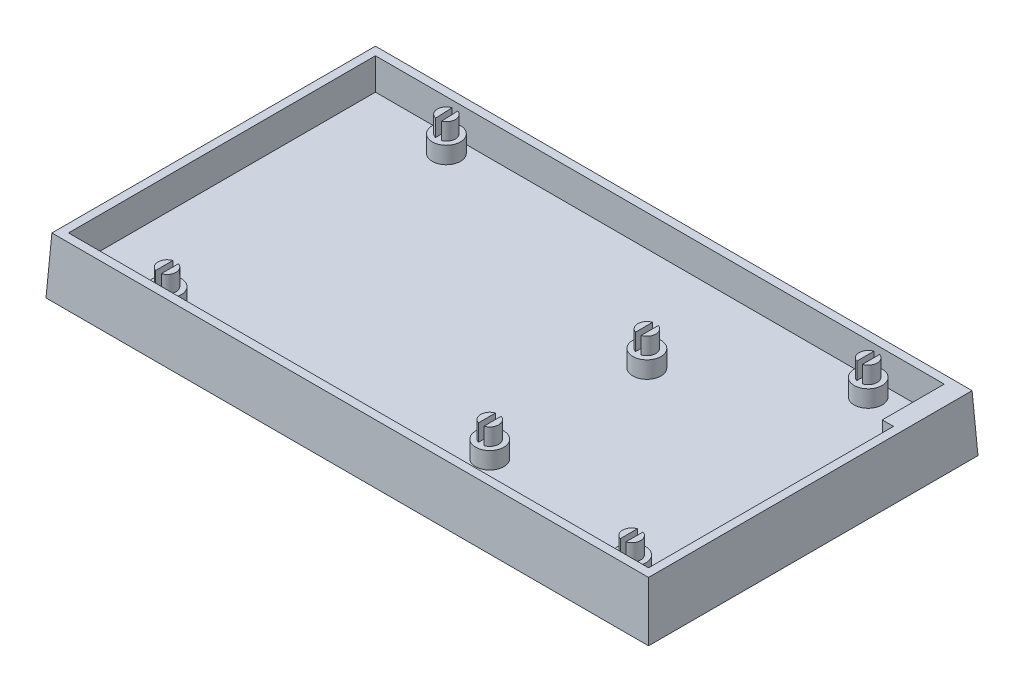
from build123d import *

# Parameters (mm, degrees)
SKETCH2_W           = 107
SKETCH2_H           = 58.5
BOSS_EXTRUDE1_DEPTH = 10
BOSS_EXTRUDE1_TAPER = 3
CUT_EXTRUDE1_START  = 10
SKETCH2_5_W         = 2
SKETCH2_5_H         = 1
CUT_EXTRUDE1_DEPTH  = 5.6
SKETCH8_W           = 107
SKETCH8_H           = 58.5
BOSS_EXTRUDE2_DEPTH = 5
BOSS_EXTRUDE2_TAPER = 45
SKETCH9_W           = 4
SKETCH9_H           = 20
BOSS_EXTRUDE3_DEPTH = 5
SKETCH10_R          = 2.5
BOSS_EXTRUDE4_DEPTH = 3
BOSS_EXTRUDE5_START = 7.4
BOSS_EXTRUDE5_DEPTH = 3


# Read off the part's stored shape, not the designer's step: Boss-Extrude5
with BuildPart() as part:
    # Sketch2 → Boss-Extrude1 (new body)
    with BuildSketch(Plane(origin=(0, 0, 0), x_dir=(1, 0, 0), z_dir=(0, 1, 0))):
        with Locations((51.5, 27.25)):
            Rectangle(SKETCH2_W, SKETCH2_H)
    extrude(amount=BOSS_EXTRUDE1_DEPTH, taper=BOSS_EXTRUDE1_TAPER)

    # Sketch2<5> → Cut-Extrude1 (cut)
    with BuildSketch(Plane(origin=(0, 0, 0), x_dir=(1, 0, 0), z_dir=(0, 1, 0)).offset(CUT_EXTRUDE1_START)):
        Polygon((0, 0), (101, 0), (101, 1), (103, 3), (103, 41.5), (101, 43.5), (101, 54.5), (0, 54.5), align=None)
        Polygon((103, 43.5), (101, 43.5), (103, 41.5), align=None)
        Polygon((103, 3), (101, 1), (103, 1), align=None)
        with Locations((102, 0.5)):
            Rectangle(SKETCH2_5_W, SKETCH2_5_H)
    extrude(amount=-CUT_EXTRUDE1_DEPTH, mode=Mode.SUBTRACT)

    # Sketch8 → Boss-Extrude2 (add)
    with BuildSketch(Plane.XZ):
        with Locations((51.5, -27.25)):
            Rectangle(SKETCH8_W, SKETCH8_H)
    extrude(amount=BOSS_EXTRUDE2_DEPTH, taper=BOSS_EXTRUDE2_TAPER)

    # Sketch9 → Boss-Extrude3 (add)
    with BuildSketch(Plane.XZ.offset(5)):
        with Locations((26.5, -27.25)):
            Rectangle(SKETCH9_W, SKETCH9_H)
        with Locations((76.5, -27.25)):
            Rectangle(SKETCH9_W, SKETCH9_H)
    extrude(amount=BOSS_EXTRUDE3_DEPTH)

    # Sketch10 → Boss-Extrude4 (add)
    # profile 1 of 6: a face of its own
    with BuildSketch(Plane(origin=(0, 4.4, 0), x_dir=(1, 0, 0), z_dir=(0, 1, 0))):
        with Locations(Location((15.7, 51.4, 0), (0, 0, 270))):
            Circle(SKETCH10_R)
    # profile 2 of 6: a face of its own
    with BuildSketch(Plane(origin=(0, 4.4, 0), x_dir=(1, 0, 0), z_dir=(0, 1, 0))):
        with Locations(Location((90.6, 51.4, 0), (0, 0, 270))):
            Circle(SKETCH10_R)
    # profile 3 of 6: a face of its own
    with BuildSketch(Plane(origin=(0, 4.4, 0), x_dir=(1, 0, 0), z_dir=(0, 1, 0))):
        with Locations(Location((66.5, 8.3, 0), (0, 0, 270))):
            Circle(SKETCH10_R)
    # profile 4 of 6: a face of its own
    with BuildSketch(Plane(origin=(0, 4.4, 0), x_dir=(1, 0, 0), z_dir=(0, 1, 0))):
        with Locations(Location((66.5, 36.2, 0), (0, 0, 270))):
            Circle(SKETCH10_R)
    # profile 5 of 6: a face of its own
    with BuildSketch(Plane(origin=(0, 4.4, 0), x_dir=(1, 0, 0), z_dir=(0, 1, 0))):
        with Locations(Location((96.9, 3.1, 0), (0, 0, 270))):
            Circle(SKETCH10_R)
        with BuildLine():
            ThreePointArc((96.4, 4.619868415), (96.9, 4.7), (97.4, 4.619868415))
            ThreePointArc((97.4, 4.619868415), (96.9, 1.5), (96.4, 4.619868415))
        make_face(mode=Mode.SUBTRACT)
    # profile 6 of 6: a face of its own
    with BuildSketch(Plane(origin=(0, 4.4, 0), x_dir=(1, 0, 0), z_dir=(0, 1, 0))):
        with Locations(Location((14.4, 3.1, 0), (0, 0, 270))):
            Circle(SKETCH10_R)
        with BuildLine():
            ThreePointArc((13.9, 1.580131585), (12.8, 3.1), (13.9, 4.619868415))
            ThreePointArc((13.9, 4.619868415), (14.4, 4.7), (14.9, 4.619868415))
            ThreePointArc((14.9, 4.619868415), (16, 3.1), (14.9, 1.580131585))
            ThreePointArc((14.9, 1.580131585), (14.4, 1.5), (13.9, 1.580131585))
        make_face(mode=Mode.SUBTRACT)
    extrude(amount=BOSS_EXTRUDE4_DEPTH)

    # Boss-Extrude5 outline → Boss-Extrude5 (add)
    with BuildSketch(Plane(origin=(0, 0, 0), x_dir=(1, 0, 0), z_dir=(0, 1, 0)).offset(BOSS_EXTRUDE5_START)):
        with BuildLine():
            ThreePointArc((96.4, 4.619868415), (95.3, 3.1), (96.4, 1.580131585))
            Line((96.4, 1.580131585), (96.4, 4.619868415))
        make_face()
        with BuildLine():
            ThreePointArc((97.4, 1.580131585), (98.5, 3.1), (97.4, 4.619868415))
            Line((97.4, 4.619868415), (97.4, 1.580131585))
        make_face()
        with BuildLine():
            ThreePointArc((13.9, 4.619868415), (12.8, 3.1), (13.9, 1.580131585))
            Line((13.9, 1.580131585), (13.9, 4.619868415))
        make_face()
        with BuildLine():
            ThreePointArc((14.9, 1.580131585), (16, 3.1), (14.9, 4.619868415))
            Line((14.9, 4.619868415), (14.9, 1.580131585))
        make_face()
        with BuildLine():
            ThreePointArc((16.332025214, 49.930121049), (17.298532633, 51.468508541), (16.203949106, 52.918563564))
            Line((16.203949106, 52.918563564), (16.332025214, 49.930121049))
        make_face()
        with BuildLine():
            ThreePointArc((15.202934006, 52.920830496), (14.101467367, 51.331491459), (15.334874522, 49.842218441))
            Line((15.334874522, 49.842218441), (15.202934006, 52.920830496))
        make_face()
        with BuildLine():
            ThreePointArc((91.1, 49.880131585), (92.2, 51.4), (91.1, 52.919868415))
            Line((91.1, 52.919868415), (91.1, 49.880131585))
        make_face()
        with BuildLine():
            ThreePointArc((90.1, 52.919868415), (89, 51.4), (90.1, 49.880131585))
            Line((90.1, 49.880131585), (90.1, 52.919868415))
        make_face()
        with BuildLine():
            ThreePointArc((67, 34.680131585), (68.1, 36.2), (67, 37.719868415))
            Line((67, 37.719868415), (67, 34.680131585))
        make_face()
        with BuildLine():
            ThreePointArc((66, 37.719868415), (64.9, 36.2), (66, 34.680131585))
            Line((66, 34.680131585), (66, 37.719868415))
        make_face()
        with BuildLine():
            ThreePointArc((67, 6.780131585), (68.1, 8.3), (67, 9.819868415))
            Line((67, 9.819868415), (67, 6.780131585))
        make_face()
        with BuildLine():
            Line((66, 6.780131585), (66, 9.819868415))
            ThreePointArc((66, 9.819868415), (64.9, 8.3), (66, 6.780131585))
        make_face()
    extrude(amount=BOSS_EXTRUDE5_DEPTH)


solid = part.part
